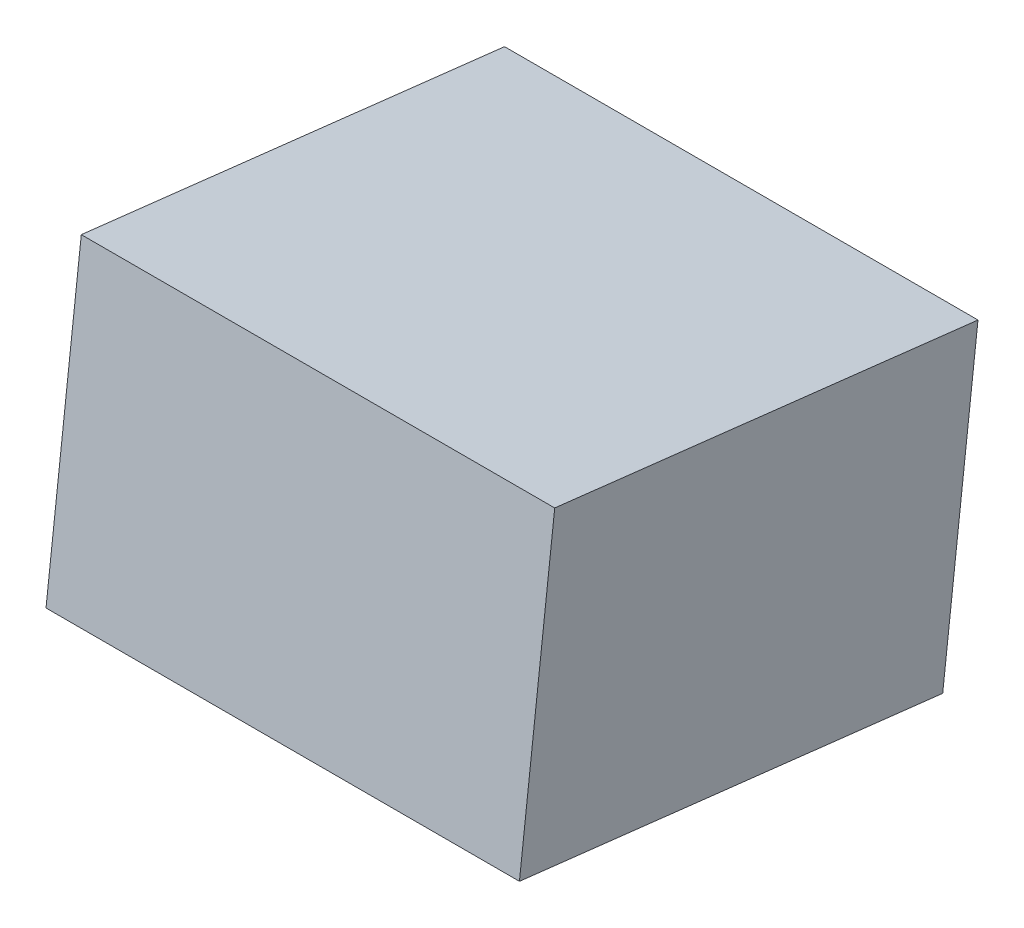
from build123d import *

# Parameters (mm, degrees)
SKETCH1_W           = 200
SKETCH1_H           = 180
BOSS_EXTRUDE1_DEPTH = 130


with BuildPart() as part:
    # Sketch1 → Boss-Extrude1 (new body)
    with BuildSketch(Plane(origin=(0, 358.879876801, -41.422455829), x_dir=(1, 0, 0), z_dir=(-6.837425950214788e-15, 0.9934047622419533, -0.1146602736566085))):
        with Locations((-131.67305734, 232.552608871)):
            Rectangle(SKETCH1_W, SKETCH1_H)
    extrude(amount=BOSS_EXTRUDE1_DEPTH)


solid = part.part
